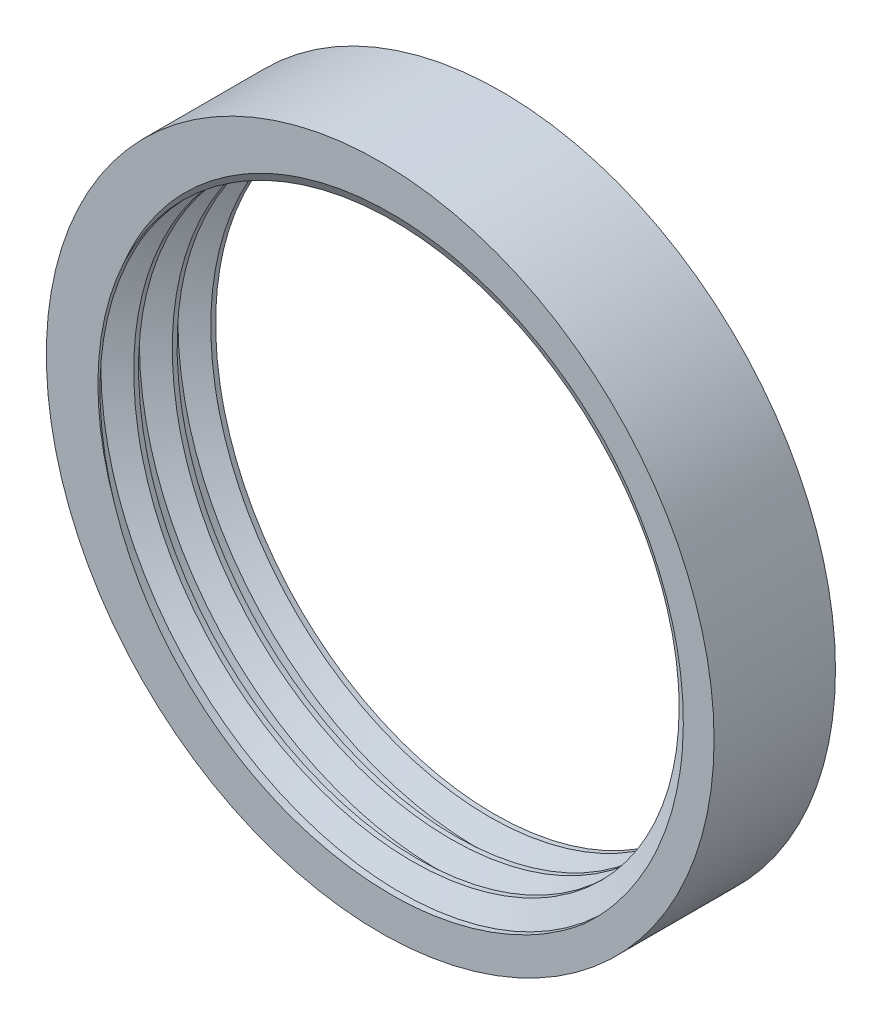
from build123d import *

# Parameters (mm, degrees)
ESBO_O1_R                = 27.5
ESBO_O1_R_2              = 23.25
RESSALTO_EXTRUS_O1_DEPTH = 10
ROSCA1_PITCH             = 3.175


with BuildPart() as part:
    # Esboço1 → Ressalto-extrusão1 (new body)
    with BuildSketch(Plane.XY):
        Circle(ESBO_O1_R)
        Circle(ESBO_O1_R_2, mode=Mode.SUBTRACT)
    extrude(amount=RESSALTO_EXTRUS_O1_DEPTH)

    # Rosca1: the profile of Perfil da rosca1 profile screwed along a right-hand helix of 7.874016 turns, 12 arcs to a turn; built about Z, then put on its axis
    rosca1_z = Axis((0, 0, 0), (0, 0, 1))
    rosca1_corners = [(23.2497, 0, -0.000173205), (23.2497, 0, 2.778298196), (24.968519153, 0, 1.785937496), (24.968519153, 0, 0.992187496)]
    with BuildLine(mode=Mode.PRIVATE) as rosca1_profile:
        Line(rosca1_corners[0], rosca1_corners[1])
        Line(rosca1_corners[1], rosca1_corners[2])
        Line(rosca1_corners[2], rosca1_corners[3])
        Line(rosca1_corners[3], rosca1_corners[0])
    rosca1_cap = Face(rosca1_profile.wire())
    rosca1_turn_angles = [0, 15, 30, 45, 60, 75, 90, 105, 120, 135, 150, 165, 180, 195, 210, 225, 240, 255, 270, 285, 300, 315, 330, 345, 360]
    rosca1_turn_weights = [1, 0.9659258262890683, 1, 0.9659258262890683, 1, 0.9659258262890683, 1, 0.9659258262890683, 1, 0.9659258262890683, 1, 0.9659258262890683, 1, 0.9659258262890683, 1, 0.9659258262890683, 1, 0.9659258262890683, 1, 0.9659258262890683, 1, 0.9659258262890683, 1, 0.9659258262890683, 1]
    rosca1_turn_rails = [Edge.make_bspline([Vector(p[0], p[1], 0).rotate(rosca1_z, rosca1_turn_angles[k]) / rosca1_turn_weights[k] + Vector(0, 0, p[2] + ROSCA1_PITCH * rosca1_turn_angles[k] / 360) for k in range(25)], [0, 0, 0, 1, 1, 2, 2, 3, 3, 4, 4, 5, 5, 6, 6, 7, 7, 8, 8, 9, 9, 10, 10, 11, 11, 12, 12, 12], 2, rosca1_turn_weights) for p in rosca1_corners]
    rosca1_turn_sides = [Face.make_surface_from_curves(rosca1_turn_rails[p[0]], rosca1_turn_rails[p[1]]) for p in [(0, 1), (1, 2), (2, 3), (3, 0)]]
    rosca1_last_angles = [2520, 2535, 2550, 2565, 2580, 2595, 2610, 2625, 2640, 2655, 2670, 2685, 2700, 2715, 2730, 2745, 2760, 2775, 2790, 2805, 2820, 2827.322834646, 2834.645669291]
    rosca1_last_weights = [1, 0.9659258262890683, 1, 0.9659258262890683, 1, 0.9659258262890683, 1, 0.9659258262890683, 1, 0.9659258262890683, 1, 0.9659258262890683, 1, 0.9659258262890683, 1, 0.9659258262890683, 1, 0.9659258262890683, 1, 0.9659258262890683, 1, 0.9918437235207197, 1]
    rosca1_last_rails = [Edge.make_bspline([Vector(p[0], p[1], 0).rotate(rosca1_z, rosca1_last_angles[k]) / rosca1_last_weights[k] + Vector(0, 0, p[2] + ROSCA1_PITCH * rosca1_last_angles[k] / 360) for k in range(23)], [0, 0, 0, 1, 1, 2, 2, 3, 3, 4, 4, 5, 5, 6, 6, 7, 7, 8, 8, 9, 9, 10, 10, 11, 11, 11], 2, rosca1_last_weights) for p in rosca1_corners]
    rosca1_last_sides = [Face.make_surface_from_curves(rosca1_last_rails[p[0]], rosca1_last_rails[p[1]]) for p in [(0, 1), (1, 2), (2, 3), (3, 0)]]
    rosca1 = Plane(origin=(0, 0, 13), x_dir=(-1, 0, 0), z_dir=(0, 0, -1)) * Solid(Shell([*[p.moved(Location((0, 0, ROSCA1_PITCH * i))) for i in range(7) for p in rosca1_turn_sides], *rosca1_last_sides, rosca1_cap, rosca1_cap.rotate(rosca1_z, 2834.645669291).moved(Location((0, 0, ROSCA1_PITCH * 2834.645669291 / 360)))]))
    add(rosca1, mode=Mode.SUBTRACT)


solid = part.part
